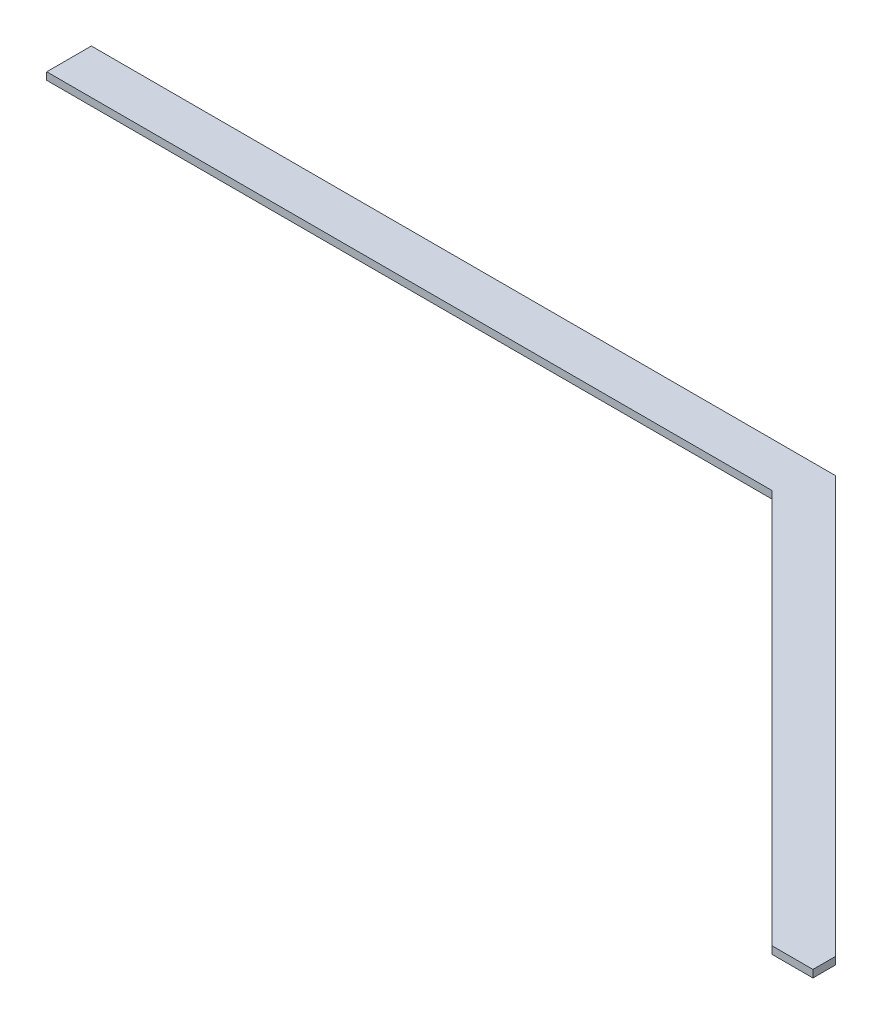
from build123d import *

# Parameters (mm, degrees)
BOSS_EXTRUDE1_DEPTH = 5


with BuildPart() as part:
    # Sketch1 → Boss-Extrude1 (new body)
    with BuildSketch(Plane(origin=(0, 0, 0), x_dir=(1, 0, 0), z_dir=(0, 1, 0))):
        Polygon((-300, 295), (-800, 295), (-800, 265), (-312.426406871, 265), (-47.426406871, 0), (-20, 0), (-20, 15), align=None)
    extrude(amount=BOSS_EXTRUDE1_DEPTH)


solid = part.part
